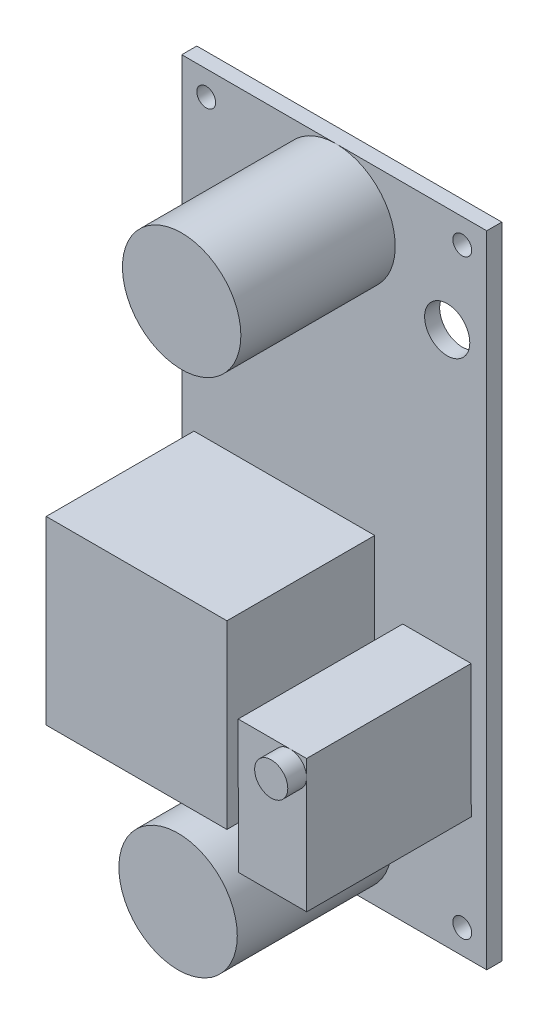
from build123d import *

# Parameters (mm, degrees)
SKETCH1_W           = 20.574
SKETCH1_H           = 43.18
BOSS_EXTRUDE1_DEPTH = 1.016
SKETCH2_R           = 1.524
CUT_EXTRUDE1_DEPTH  = 48.841761381
SKETCH3_R           = 0.635
CUT_EXTRUDE2_DEPTH  = 2.54
SKETCH4_W           = 0.79375
SKETCH4_H           = 0.071233975
SKETCH4_W_2         = 0.081410257
SKETCH4_H_2         = 0.305288462
SKETCH4_H_3         = 0.071233974
BOSS_EXTRUDE2_DEPTH = 0.00254
SKETCH5_W           = 12.192
SKETCH5_H           = 12.192
BOSS_EXTRUDE3_DEPTH = 9.9695
SKETCH6_R           = 3.99415
BOSS_EXTRUDE4_DEPTH = 10.414
BOSS_EXTRUDE5_DEPTH = 11.0998
SKETCH8_R           = 1.1176
BOSS_EXTRUDE6_DEPTH = 1.27


with BuildPart() as part:
    # Sketch1 → Boss-Extrude1 (new body)
    with BuildSketch(Plane.XY):
        with Locations((10.287, 21.59)):
            Rectangle(SKETCH1_W, SKETCH1_H)
    extrude(amount=BOSS_EXTRUDE1_DEPTH)

    # Sketch2 → Cut-Extrude1 (cut, through all)
    with BuildSketch(Plane.XY.offset(1.016)):
        with Locations((17.907, 36.068)):
            Circle(SKETCH2_R)
        with Locations((3.0988, 6.35)):
            Circle(SKETCH2_R)
    extrude(amount=-CUT_EXTRUDE1_DEPTH, mode=Mode.SUBTRACT)

    # Sketch3 → Cut-Extrude2 (cut)
    with BuildSketch(Plane.XY.offset(1.016)):
        with Locations((18.923, 41.529)):
            Circle(SKETCH3_R)
        with Locations((18.923, 1.651)):
            Circle(SKETCH3_R)
        with Locations((1.651, 1.651)):
            Circle(SKETCH3_R)
        with Locations((1.651, 41.529)):
            Circle(SKETCH3_R)
    extrude(amount=-CUT_EXTRUDE2_DEPTH, mode=Mode.SUBTRACT)

    # Sketch4 → Boss-Extrude2 (add)
    # profile 1 of 14: a face of its own
    with BuildSketch(Plane(origin=(0, 0, 0), x_dir=(-1, 0, 0), z_dir=(0, 0, -1))):
        Polygon((-17.848673525, 42.286725962), (-18.082728012, 42.286725962), (-18.082728012, 42.357959936), (-17.848673525, 42.357959936), (-17.848673525, 42.592014423), (-17.777439551, 42.592014423), (-17.777439551, 42.357959936), (-17.543385063, 42.357959936), (-17.543385063, 42.286725962), (-17.777439551, 42.286725962), (-17.777439551, 42.052671474), (-17.848673525, 42.052671474), align=None)
    # profile 2 of 14: a face of its own
    with BuildSketch(Plane(origin=(0, 0, 0), x_dir=(-1, 0, 0), z_dir=(0, 0, -1))):
        Polygon((-17.421269679, 41.279274038), (-18.215019679, 41.279274038), (-18.215019679, 41.294220453), (-17.590291363, 41.818616987), (-18.215019679, 41.818616987), (-18.215019679, 41.889850962), (-17.421269679, 41.889850962), (-17.421269679, 41.873632512), (-18.044566954, 41.350508013), (-17.421269679, 41.350508013), align=None)
    # profile 3 of 14: a face of its own
    with BuildSketch(Plane(origin=(0, 0, 0), x_dir=(-1, 0, 0), z_dir=(0, 0, -1))):
        with Locations((-17.818144679, 41.070660257)):
            Rectangle(SKETCH4_W, SKETCH4_H)
    # profile 4 of 14: a face of its own
    with BuildSketch(Plane(origin=(0, 0, 0), x_dir=(-1, 0, 0), z_dir=(0, 0, -1))):
        with Locations((-2.746900665, 42.32743109)):
            Rectangle(SKETCH4_W_2, SKETCH4_H_2)
    # profile 5 of 14: a face of its own
    with BuildSketch(Plane(origin=(0, 0, 0), x_dir=(-1, 0, 0), z_dir=(0, 0, -1))):
        Polygon((-2.441612203, 41.431918269), (-3.235362203, 41.431918269), (-3.235362203, 41.446864683), (-2.610633888, 41.971261218), (-3.235362203, 41.971261218), (-3.235362203, 42.042495192), (-2.441612203, 42.042495192), (-2.441612203, 42.026276743), (-3.064909479, 41.503152244), (-2.441612203, 41.503152244), align=None)
    # profile 6 of 14: a face of its own
    with BuildSketch(Plane(origin=(0, 0, 0), x_dir=(-1, 0, 0), z_dir=(0, 0, -1))):
        with Locations((-2.838487203, 41.223304487)):
            Rectangle(SKETCH4_W, SKETCH4_H_3)
    # profile 7 of 14: a face of its own
    with BuildSketch(Plane(origin=(0, 0, 0), x_dir=(-1, 0, 0), z_dir=(0, 0, -1))):
        with BuildLine():
            add(Edge.make_bspline(
                [(-18.235372243, 1.075856171), (-18.235006246, 1.090555326), (-18.234287397, 1.11942568), (-18.228603062, 1.161816811), (-18.21924724, 1.202408219), (-18.206034822, 1.241223241), (-18.188906583, 1.278114253), (-18.168100678, 1.313185445), (-18.143490664, 1.346331712), (-18.115437918, 1.377324896), (-18.084715583, 1.405597859), (-18.05182674, 1.430407531), (-18.017184889, 1.451336831), (-17.980788224, 1.468469742), (-17.94272172, 1.481920213), (-17.902772035, 1.491199415), (-17.861200825, 1.497127353), (-17.832846501, 1.497820335), (-17.818462688, 1.498171876)],
                knots=[0, 0, 0, 0, 1.065064174, 2.09187391, 3.093564831, 4.079973196, 5.057907931, 6.036227367, 7.030399151, 8.044883615, 9.061699972, 10.052012555, 11.025713132, 11.989727027, 12.962874294, 13.945865945, 14.957962116, 16, 16, 16, 16], degree=3))
            add(Edge.make_bspline(
                [(-17.818462688, 1.498171876), (-17.804184912, 1.497820217), (-17.776041763, 1.497127054), (-17.734733171, 1.491194605), (-17.695028998, 1.481878809), (-17.65701774, 1.468636278), (-17.620694998, 1.451490219), (-17.586026922, 1.430530108), (-17.553050233, 1.405767522), (-17.522116245, 1.37761462), (-17.493818809, 1.346833758), (-17.468859368, 1.314071317), (-17.447920958, 1.27943039), (-17.430596773, 1.24326996), (-17.417426608, 1.205306084), (-17.407838293, 1.165815025), (-17.401969203, 1.124581624), (-17.401271659, 1.096493068), (-17.400917115, 1.082216348)],
                knots=[0, 0, 0, 0, 1.043748596, 2.057349401, 3.045489418, 4.02252776, 4.995289225, 5.97782527, 6.980224157, 8.006516136, 9.032559198, 10.034193337, 11.013412982, 11.987833483, 12.961212594, 13.946489799, 14.956251404, 16, 16, 16, 16], degree=3))
            add(Edge.make_bspline(
                [(-17.400917115, 1.082216348), (-17.401268493, 1.067832618), (-17.401961155, 1.039478458), (-17.407898723, 0.997854881), (-17.417183626, 0.957877607), (-17.43045273, 0.919660959), (-17.447601638, 0.883183627), (-17.468512274, 0.848374269), (-17.493324251, 0.815372605), (-17.521483456, 0.784452245), (-17.552138433, 0.756160909), (-17.584984773, 0.731495836), (-17.619378064, 0.710580498), (-17.655413752, 0.693489171), (-17.692917633, 0.679958124), (-17.732139877, 0.670726852), (-17.772856872, 0.664754235), (-17.800579815, 0.664065975), (-17.814646582, 0.663716748)],
                knots=[0, 0, 0, 0, 1.053102029, 2.075944431, 3.073151272, 4.055350789, 5.033113405, 6.020478099, 7.024410459, 8.052272461, 9.079885166, 10.07527673, 11.055994387, 12.023226415, 12.992069828, 13.970394897, 14.97016774, 16, 16, 16, 16], degree=3))
            add(Edge.make_bspline(
                [(-17.814646582, 0.663716748), (-17.824088276, 0.663837996), (-17.842852554, 0.664078962), (-17.870716944, 0.666979935), (-17.898133218, 0.671189464), (-17.925023415, 0.677222397), (-17.95132171, 0.68511265), (-17.977209472, 0.694422664), (-18.002424353, 0.705793664), (-18.0270858, 0.718648026), (-18.050809379, 0.7329949), (-18.073233856, 0.748841722), (-18.094547403, 0.765631886), (-18.114197706, 0.784038584), (-18.13275641, 0.80345517), (-18.149938312, 0.824196624), (-18.165898346, 0.846136383), (-18.180281173, 0.869368851), (-18.193289405, 0.893321567), (-18.204452218, 0.918013265), (-18.214033021, 0.943108595), (-18.221798351, 0.968725095), (-18.227928831, 0.994794742), (-18.232103356, 1.021374432), (-18.235011728, 1.048442991), (-18.235251554, 1.06667913), (-18.235372243, 1.075856171)],
                knots=[0, 0, 0, 0, 1.037015668, 2.060948919, 3.074880161, 4.083647147, 5.086022904, 6.090072063, 7.104153813, 8.122640571, 9.144368836, 10.147691507, 11.138137339, 12.123020368, 13.103399296, 14.087645067, 15.080126199, 16.082011238, 17.087798457, 18.072939717, 19.057185487, 20.037253025, 21.01195951, 21.997135196, 22.992090687, 24, 24, 24, 24], degree=3))
        make_face()
        with BuildLine():
            add(Edge.make_bspline(
                [(-18.153961986, 1.079354268), (-18.153870483, 1.071821568), (-18.153688352, 1.056828179), (-18.151276124, 1.034540075), (-18.14786271, 1.012538327), (-18.142905235, 0.990865513), (-18.136492957, 0.96947618), (-18.128759243, 0.948360832), (-18.119411891, 0.927591868), (-18.108899658, 0.907195232), (-18.096959443, 0.887642022), (-18.0842801, 0.868885146), (-18.070390525, 0.851412487), (-18.055591099, 0.83498402), (-18.039753387, 0.819640601), (-18.022981396, 0.805388997), (-18.005202585, 0.792240895), (-17.986490119, 0.780354528), (-17.966948474, 0.769776589), (-17.946951204, 0.760305717), (-17.926263297, 0.752454725), (-17.905013853, 0.746235569), (-17.883296514, 0.740956932), (-17.860992955, 0.737645779), (-17.838180065, 0.735209784), (-17.822762664, 0.735037741), (-17.814964591, 0.734950723)],
                knots=[0, 0, 0, 0, 1.008406545, 2.007172654, 2.999155034, 3.989332444, 4.982025741, 5.988181096, 6.998684226, 8.030553839, 9.059268815, 10.065399129, 11.060956322, 12.046057109, 13.024974577, 14.012068307, 14.991706172, 15.984221787, 16.978487447, 17.966117052, 18.945677757, 19.938371053, 20.93015022, 21.936155317, 22.956113857, 24, 24, 24, 24], degree=3))
            add(Edge.make_bspline(
                [(-17.814964591, 0.734950723), (-17.803498062, 0.735240505), (-17.780939853, 0.735810595), (-17.747878001, 0.740780821), (-17.716073226, 0.748497586), (-17.685715099, 0.759685439), (-17.656668243, 0.773957752), (-17.629045699, 0.791367078), (-17.602855614, 0.812072847), (-17.578292949, 0.835578949), (-17.555882556, 0.861282251), (-17.536183703, 0.888562295), (-17.519604599, 0.917203249), (-17.505744841, 0.947040035), (-17.495303475, 0.978327394), (-17.487858787, 1.010864724), (-17.483033673, 1.044652744), (-17.482565039, 1.067677321), (-17.482327371, 1.079354268)],
                knots=[0, 0, 0, 0, 1.032022337, 2.030307203, 3.003823408, 3.974715386, 4.937372378, 5.913284036, 6.909147208, 7.938749767, 8.970518239, 9.975863271, 10.963918693, 11.946286286, 12.933361397, 13.927862637, 14.949112547, 16, 16, 16, 16], degree=3))
            add(Edge.make_bspline(
                [(-17.482327371, 1.079354268), (-17.482435122, 1.08720324), (-17.482648823, 1.102770107), (-17.484804263, 1.125923461), (-17.488253848, 1.148661836), (-17.493245074, 1.170943221), (-17.499409188, 1.192796808), (-17.507055136, 1.214156657), (-17.516220796, 1.235015675), (-17.526435619, 1.255476429), (-17.538039384, 1.275080784), (-17.550547797, 1.293723885), (-17.564192296, 1.311166441), (-17.57879296, 1.3275872), (-17.594581987, 1.342823088), (-17.611252048, 1.357034115), (-17.629068593, 1.369954882), (-17.647704417, 1.381800954), (-17.667103591, 1.39250796), (-17.687155839, 1.401704885), (-17.707753613, 1.409559249), (-17.728912047, 1.415890756), (-17.750583548, 1.420854682), (-17.772799132, 1.424274425), (-17.795513815, 1.426666705), (-17.810877157, 1.426847011), (-17.818621692, 1.426937902)],
                knots=[0, 0, 0, 0, 1.047334373, 2.07717862, 3.100662057, 4.115010574, 5.122652213, 6.129548646, 7.140165612, 8.16200981, 9.179904151, 10.178566626, 11.156366481, 12.133321541, 13.108841334, 14.082538371, 15.054589433, 16.043660176, 17.028268541, 18.009491307, 18.985652105, 19.968123554, 20.954864208, 21.950389976, 22.966808393, 24, 24, 24, 24], degree=3))
            add(Edge.make_bspline(
                [(-17.818621692, 1.426937902), (-17.826313244, 1.426846935), (-17.841570854, 1.426666486), (-17.864127147, 1.424275604), (-17.886182786, 1.420850937), (-17.907651184, 1.415915466), (-17.928537814, 1.409554092), (-17.948823057, 1.401710179), (-17.968582492, 1.392460659), (-17.987767252, 1.38184521), (-18.00617659, 1.369912738), (-18.023775461, 1.356873697), (-18.040234844, 1.34250397), (-18.055955513, 1.327210359), (-18.07062302, 1.310625173), (-18.084180694, 1.292745516), (-18.097239397, 1.27401657), (-18.108796494, 1.254014793), (-18.119522891, 1.233446289), (-18.128674153, 1.212321281), (-18.136533791, 1.190941465), (-18.142924377, 1.169221362), (-18.14784372, 1.147171237), (-18.151279179, 1.124803914), (-18.153687524, 1.102197468), (-18.153870208, 1.086992831), (-18.153961986, 1.079354268)],
                knots=[0, 0, 0, 0, 1.029877221, 2.042951179, 3.035109885, 4.018542222, 4.991021277, 5.957494829, 6.929429462, 7.911425532, 8.892163142, 9.866273635, 10.842761649, 11.81676864, 12.802607151, 13.805177466, 14.821356543, 15.858816981, 16.897175917, 17.927346774, 18.940346092, 19.946830556, 20.957962087, 21.964146003, 22.97721996, 24, 24, 24, 24], degree=3))
        make_face(mode=Mode.SUBTRACT)
    # profile 8 of 14: a face of its own
    with BuildSketch(Plane(origin=(0, 0, 0), x_dir=(-1, 0, 0), z_dir=(0, 0, -1))):
        with BuildLine():
            Line((-18.215019679, 1.660992389), (-18.215019679, 1.732226364))
            Line((-18.215019679, 1.732226364), (-17.739437497, 1.732226364))
            add(Edge.make_bspline(
                [(-17.739437497, 1.732226364), (-17.73270633, 1.732215763), (-17.719932781, 1.732195646), (-17.701751756, 1.73233002), (-17.685588181, 1.732706341), (-17.67137975, 1.732943595), (-17.659191663, 1.733471401), (-17.648957887, 1.733901851), (-17.64072688, 1.734455334), (-17.635923349, 1.735120523), (-17.633858571, 1.735406452)],
                knots=[0, 0, 0, 0, 1.528628734, 2.90083645, 4.128790002, 5.200304208, 6.127813768, 6.898992206, 7.526736466, 8, 8, 8, 8], degree=3))
            add(Edge.make_bspline(
                [(-17.633858571, 1.735406452), (-17.62635228, 1.736567251), (-17.611861722, 1.738808121), (-17.59124176, 1.744761694), (-17.572623805, 1.752698767), (-17.555587904, 1.76254518), (-17.54024232, 1.774986165), (-17.526469275, 1.790432033), (-17.513953078, 1.808605859), (-17.503040753, 1.829247266), (-17.493977148, 1.851240722), (-17.487195246, 1.87379776), (-17.483044725, 1.896483032), (-17.482565397, 1.911672669), (-17.482327371, 1.919215546)],
                knots=[0, 0, 0, 0, 1.042777144, 2.01303441, 2.939567723, 3.817555404, 4.708046775, 5.641195415, 6.651191522, 7.732783915, 8.843021186, 9.914367358, 10.964315445, 12, 12, 12, 12], degree=3))
            add(Edge.make_bspline(
                [(-17.482327371, 1.919215546), (-17.482569555, 1.925691696), (-17.483052524, 1.938606591), (-17.486080133, 1.957785642), (-17.491429047, 1.976523967), (-17.498715245, 1.994674361), (-17.507675315, 2.011941849), (-17.518409332, 2.027883715), (-17.530912384, 2.042170214), (-17.544769217, 2.055207442), (-17.560384265, 2.066493473), (-17.577380814, 2.076472089), (-17.596212068, 2.084396945), (-17.609438251, 2.088409275), (-17.616209082, 2.090463293)],
                knots=[0, 0, 0, 0, 0.994718802, 1.98369237, 2.973235266, 3.981451368, 4.982709966, 5.955777334, 6.925228988, 7.892833478, 8.871333226, 9.877970804, 10.913677552, 12, 12, 12, 12], degree=3))
            add(Edge.make_bspline(
                [(-17.616209082, 2.090463293), (-17.619009562, 2.091143678), (-17.625250161, 2.092659852), (-17.635800525, 2.094076592), (-17.648248648, 2.095552179), (-17.66268397, 2.096576019), (-17.679058119, 2.097574153), (-17.697456396, 2.098171296), (-17.717811992, 2.098447302), (-17.732017206, 2.098529553), (-17.739437497, 2.098572518)],
                knots=[0, 0, 0, 0, 0.558680831, 1.244966039, 2.062412453, 2.990489873, 4.051219941, 5.244515665, 6.560634259, 8, 8, 8, 8], degree=3))
            Line((-17.739437497, 2.098572518), (-18.215019679, 2.098572518))
            Line((-18.215019679, 2.098572518), (-18.215019679, 2.169806492))
            Line((-18.215019679, 2.169806492), (-17.735621392, 2.169806492))
            add(Edge.make_bspline(
                [(-17.735621392, 2.169806492), (-17.726981225, 2.169748853), (-17.710119415, 2.169636367), (-17.68541078, 2.168661171), (-17.661971884, 2.167105699), (-17.639799097, 2.164909962), (-17.618973411, 2.161993969), (-17.599357652, 2.15878121), (-17.581059969, 2.154618267), (-17.563869254, 2.149791786), (-17.547422608, 2.144353002), (-17.531844499, 2.137185029), (-17.516677396, 2.129144183), (-17.50209113, 2.119684551), (-17.488178375, 2.108801656), (-17.474578981, 2.096912435), (-17.461698248, 2.083597827), (-17.449377313, 2.069251103), (-17.43791884, 2.053968725), (-17.427947371, 2.037652013), (-17.419827892, 2.020391052), (-17.412621693, 2.002594567), (-17.407499711, 1.983835879), (-17.403605234, 1.964348652), (-17.401410977, 1.944017298), (-17.401083131, 1.930191724), (-17.400917115, 1.923190657)],
                knots=[0, 0, 0, 0, 1.316707045, 2.569633854, 3.76780728, 4.896239288, 5.964314126, 6.972204208, 7.924543903, 8.822147865, 9.693191779, 10.560896119, 11.431827672, 12.307838457, 13.206132673, 14.12176355, 15.058527151, 16.026630406, 17.00238624, 17.966538933, 18.934743273, 19.906713913, 20.888635248, 21.892958714, 22.933025263, 24, 24, 24, 24], degree=3))
            add(Edge.make_bspline(
                [(-17.400917115, 1.923190657), (-17.401094965, 1.915554929), (-17.401443906, 1.90057366), (-17.403446527, 1.878499567), (-17.407208976, 1.857334361), (-17.412030737, 1.836871477), (-17.418572259, 1.817308609), (-17.426610044, 1.798651521), (-17.435786396, 1.780685991), (-17.446629704, 1.763816778), (-17.458453601, 1.7479055), (-17.471440856, 1.733445785), (-17.485096846, 1.720070574), (-17.49993579, 1.708369416), (-17.51565392, 1.697899734), (-17.532325166, 1.688892233), (-17.549927179, 1.681155104), (-17.562163091, 1.677162285), (-17.568348755, 1.675143782)],
                knots=[0, 0, 0, 0, 1.138939089, 2.234594419, 3.301501784, 4.342532435, 5.367382236, 6.373123747, 7.370098489, 8.372230273, 9.360297234, 10.323289009, 11.268038109, 12.20748145, 13.137029304, 14.081414587, 15.030090602, 16, 16, 16, 16], degree=3))
            add(Edge.make_bspline(
                [(-17.568348755, 1.675143782), (-17.572574357, 1.673969676), (-17.581739781, 1.671423015), (-17.596908681, 1.668695849), (-17.614374564, 1.666403254), (-17.634138626, 1.664247529), (-17.656216185, 1.662975498), (-17.680597671, 1.661860293), (-17.707312566, 1.660984533), (-17.725921358, 1.660989697), (-17.735621392, 1.660992389)],
                knots=[0, 0, 0, 0, 0.625038921, 1.35572334, 2.194682327, 3.136881307, 4.189498639, 5.346923369, 6.617055217, 8, 8, 8, 8], degree=3))
            Line((-17.735621392, 1.660992389), (-18.215019679, 1.660992389))
        make_face()
    # profile 9 of 14: a face of its own
    with BuildSketch(Plane(origin=(0, 0, 0), x_dir=(-1, 0, 0), z_dir=(0, 0, -1))):
        Polygon((-18.133609422, 2.291921876), (-18.215019679, 2.291921876), (-18.215019679, 2.709149441), (-18.133609422, 2.709149441), (-18.133609422, 2.536152646), (-17.421269679, 2.536152646), (-17.421269679, 2.464918671), (-18.133609422, 2.464918671), align=None)
    # profile 10 of 14: a face of its own
    with BuildSketch(Plane(origin=(0, 0, 0), x_dir=(-1, 0, 0), z_dir=(0, 0, -1))):
        Polygon((-17.848673525, 3.044966748), (-18.082728012, 3.044966748), (-18.082728012, 3.116200723), (-17.848673525, 3.116200723), (-17.848673525, 3.35025521), (-17.777439551, 3.35025521), (-17.777439551, 3.116200723), (-17.543385063, 3.116200723), (-17.543385063, 3.044966748), (-17.777439551, 3.044966748), (-17.777439551, 2.810912261), (-17.848673525, 2.810912261), align=None)
    # profile 11 of 14: a face of its own
    with BuildSketch(Plane(origin=(0, 0, 0), x_dir=(-1, 0, 0), z_dir=(0, 0, -1))):
        with BuildLine():
            add(Edge.make_bspline(
                [(-3.255714767, 1.228500356), (-3.25534877, 1.243199511), (-3.254629921, 1.272069864), (-3.248945586, 1.314460995), (-3.239589764, 1.355052404), (-3.226377347, 1.393867425), (-3.209249107, 1.430758437), (-3.188443202, 1.465829629), (-3.163833189, 1.498975897), (-3.135780442, 1.52996908), (-3.105058107, 1.558242044), (-3.072169264, 1.583051716), (-3.037527413, 1.603981015), (-3.001130748, 1.621113927), (-2.963064244, 1.634564398), (-2.923114559, 1.6438436), (-2.88154335, 1.649771537), (-2.853189025, 1.650464519), (-2.838805212, 1.650816061)],
                knots=[0, 0, 0, 0, 1.065064174, 2.09187391, 3.093564831, 4.079973196, 5.057907931, 6.036227367, 7.030399151, 8.044883615, 9.061699972, 10.052012555, 11.025713132, 11.989727027, 12.962874294, 13.945865945, 14.957962116, 16, 16, 16, 16], degree=3))
            add(Edge.make_bspline(
                [(-2.838805212, 1.650816061), (-2.824527436, 1.650464401), (-2.796384287, 1.649771238), (-2.755075695, 1.64383879), (-2.715371522, 1.634522994), (-2.677360264, 1.621280462), (-2.641037522, 1.604134404), (-2.606369446, 1.583174293), (-2.573392757, 1.558411706), (-2.54245877, 1.530258805), (-2.514161333, 1.499477943), (-2.489201892, 1.466715501), (-2.468263482, 1.432074574), (-2.450939297, 1.395914144), (-2.437769132, 1.357950268), (-2.428180817, 1.31845921), (-2.422311727, 1.277225808), (-2.421614183, 1.249137252), (-2.421259639, 1.234860532)],
                knots=[0, 0, 0, 0, 1.043748596, 2.057349401, 3.045489418, 4.02252776, 4.995289225, 5.97782527, 6.980224157, 8.006516136, 9.032559198, 10.034193337, 11.013412982, 11.987833483, 12.961212594, 13.946489799, 14.956251404, 16, 16, 16, 16], degree=3))
            add(Edge.make_bspline(
                [(-2.421259639, 1.234860532), (-2.421611018, 1.220476803), (-2.422303679, 1.192122643), (-2.428241248, 1.150499065), (-2.43752615, 1.110521791), (-2.450795255, 1.072305144), (-2.467944162, 1.035827811), (-2.488854798, 1.001018453), (-2.513666775, 0.96801679), (-2.54182598, 0.937096429), (-2.572480957, 0.908805093), (-2.605327297, 0.884140021), (-2.639720588, 0.863224682), (-2.675756277, 0.846133355), (-2.713260158, 0.832602308), (-2.752482402, 0.823371037), (-2.793199397, 0.817398419), (-2.82092234, 0.816710159), (-2.834989106, 0.816360933)],
                knots=[0, 0, 0, 0, 1.053102029, 2.075944431, 3.073151272, 4.055350789, 5.033113405, 6.020478099, 7.024410459, 8.052272461, 9.079885166, 10.07527673, 11.055994387, 12.023226415, 12.992069828, 13.970394897, 14.97016774, 16, 16, 16, 16], degree=3))
            add(Edge.make_bspline(
                [(-2.834989106, 0.816360933), (-2.844430801, 0.81648218), (-2.863195079, 0.816723146), (-2.891059468, 0.819624119), (-2.918475743, 0.823833648), (-2.94536594, 0.829866582), (-2.971664234, 0.837756835), (-2.997551997, 0.847066848), (-3.022766877, 0.858437849), (-3.047428325, 0.87129221), (-3.071151903, 0.885639084), (-3.09357638, 0.901485906), (-3.114889928, 0.91827607), (-3.13454023, 0.936682768), (-3.153098935, 0.956099355), (-3.170280836, 0.976840808), (-3.18624087, 0.998780567), (-3.200623697, 1.022013036), (-3.21363193, 1.045965752), (-3.224794742, 1.070657449), (-3.234375546, 1.095752779), (-3.242140876, 1.12136928), (-3.248271355, 1.147438926), (-3.25244588, 1.174018617), (-3.255354252, 1.201087176), (-3.255594078, 1.219323314), (-3.255714767, 1.228500356)],
                knots=[0, 0, 0, 0, 1.037015668, 2.060948919, 3.074880161, 4.083647147, 5.086022904, 6.090072063, 7.104153813, 8.122640571, 9.144368836, 10.147691507, 11.138137339, 12.123020368, 13.103399296, 14.087645067, 15.080126199, 16.082011238, 17.087798457, 18.072939717, 19.057185487, 20.037253025, 21.01195951, 21.997135196, 22.992090687, 24, 24, 24, 24], degree=3))
        make_face()
        with BuildLine():
            add(Edge.make_bspline(
                [(-3.174304511, 1.231998453), (-3.174213008, 1.224465752), (-3.174030876, 1.209472364), (-3.171618649, 1.187184259), (-3.168205234, 1.165182512), (-3.163247759, 1.143509697), (-3.156835481, 1.122120364), (-3.149101767, 1.101005017), (-3.139754415, 1.080236052), (-3.129242182, 1.059839417), (-3.117301967, 1.040286206), (-3.104622625, 1.02152933), (-3.090733049, 1.004056671), (-3.075933623, 0.987628204), (-3.060095911, 0.972284785), (-3.043323921, 0.958033181), (-3.025545109, 0.94488508), (-3.006832643, 0.932998712), (-2.987290999, 0.922420773), (-2.967293728, 0.912949901), (-2.946605821, 0.905098909), (-2.925356377, 0.898879754), (-2.903639038, 0.893601116), (-2.881335479, 0.890289964), (-2.858522589, 0.887853968), (-2.843105188, 0.887681926), (-2.835307115, 0.887594907)],
                knots=[0, 0, 0, 0, 1.008406545, 2.007172654, 2.999155034, 3.989332444, 4.982025741, 5.988181096, 6.998684226, 8.030553839, 9.059268815, 10.065399129, 11.060956322, 12.046057109, 13.024974577, 14.012068307, 14.991706172, 15.984221787, 16.978487447, 17.966117052, 18.945677757, 19.938371053, 20.93015022, 21.936155317, 22.956113857, 24, 24, 24, 24], degree=3))
            add(Edge.make_bspline(
                [(-2.835307115, 0.887594907), (-2.823840586, 0.887884689), (-2.801282377, 0.88845478), (-2.768220525, 0.893425005), (-2.736415751, 0.901141771), (-2.706057623, 0.912329623), (-2.677010767, 0.926601937), (-2.649388223, 0.944011262), (-2.623198139, 0.964717031), (-2.598635473, 0.988223133), (-2.576225081, 1.013926436), (-2.556526228, 1.041206479), (-2.539947124, 1.069847433), (-2.526087365, 1.099684219), (-2.515646, 1.130971578), (-2.508201311, 1.163508908), (-2.503376197, 1.197296928), (-2.502907563, 1.220321505), (-2.502669895, 1.231998453)],
                knots=[0, 0, 0, 0, 1.032022337, 2.030307203, 3.003823408, 3.974715386, 4.937372378, 5.913284036, 6.909147208, 7.938749767, 8.970518239, 9.975863271, 10.963918693, 11.946286286, 12.933361397, 13.927862637, 14.949112547, 16, 16, 16, 16], degree=3))
            add(Edge.make_bspline(
                [(-2.502669895, 1.231998453), (-2.502777646, 1.239847424), (-2.502991348, 1.255414292), (-2.505146787, 1.278567645), (-2.508596373, 1.30130602), (-2.513587598, 1.323587405), (-2.519751712, 1.345440992), (-2.527397661, 1.366800842), (-2.53656332, 1.387659859), (-2.546778144, 1.408120614), (-2.558381908, 1.427724969), (-2.570890322, 1.446368069), (-2.584534821, 1.463810625), (-2.599135484, 1.480231384), (-2.614924511, 1.495467272), (-2.631594572, 1.509678299), (-2.649411117, 1.522599066), (-2.668046941, 1.534445138), (-2.687446115, 1.545152145), (-2.707498363, 1.554349069), (-2.728096137, 1.562203433), (-2.749254572, 1.568534941), (-2.770926072, 1.573498866), (-2.793141656, 1.576918609), (-2.815856339, 1.57931089), (-2.831219681, 1.579491196), (-2.838964216, 1.579582087)],
                knots=[0, 0, 0, 0, 1.047334373, 2.07717862, 3.100662057, 4.115010574, 5.122652213, 6.129548646, 7.140165612, 8.16200981, 9.179904151, 10.178566626, 11.156366481, 12.133321541, 13.108841334, 14.082538371, 15.054589433, 16.043660176, 17.028268541, 18.009491307, 18.985652105, 19.968123554, 20.954864208, 21.950389976, 22.966808393, 24, 24, 24, 24], degree=3))
            add(Edge.make_bspline(
                [(-2.838964216, 1.579582087), (-2.846655768, 1.57949112), (-2.861913378, 1.579310671), (-2.884469671, 1.576919788), (-2.90652531, 1.573495122), (-2.927993708, 1.56855965), (-2.948880338, 1.562198277), (-2.969165581, 1.554354363), (-2.988925016, 1.545104843), (-3.008109776, 1.534489394), (-3.026519114, 1.522556923), (-3.044117985, 1.509517881), (-3.060577369, 1.495148154), (-3.076298037, 1.479854543), (-3.090965544, 1.463269357), (-3.104523218, 1.445389701), (-3.117581921, 1.426660755), (-3.129139018, 1.406658978), (-3.139865415, 1.386090473), (-3.149016677, 1.364965465), (-3.156876316, 1.343585649), (-3.163266901, 1.321865546), (-3.168186245, 1.299815421), (-3.171621703, 1.277448099), (-3.174030048, 1.254841652), (-3.174212733, 1.239637016), (-3.174304511, 1.231998453)],
                knots=[0, 0, 0, 0, 1.029877221, 2.042951179, 3.035109885, 4.018542222, 4.991021277, 5.957494829, 6.929429462, 7.911425532, 8.892163142, 9.866273635, 10.842761649, 11.81676864, 12.802607151, 13.805177466, 14.821356543, 15.858816981, 16.897175917, 17.927346774, 18.940346092, 19.946830556, 20.957962087, 21.964146003, 22.97721996, 24, 24, 24, 24], degree=3))
        make_face(mode=Mode.SUBTRACT)
    # profile 12 of 14: a face of its own
    with BuildSketch(Plane(origin=(0, 0, 0), x_dir=(-1, 0, 0), z_dir=(0, 0, -1))):
        with BuildLine():
            Line((-3.235362203, 1.813636574), (-3.235362203, 1.884870548))
            Line((-3.235362203, 1.884870548), (-2.759780022, 1.884870548))
            add(Edge.make_bspline(
                [(-2.759780022, 1.884870548), (-2.753048855, 1.884859947), (-2.740275306, 1.88483983), (-2.72209428, 1.884974204), (-2.705930705, 1.885350525), (-2.691722274, 1.885587779), (-2.679534187, 1.886115585), (-2.669300411, 1.886546035), (-2.661069404, 1.887099518), (-2.656265873, 1.887764707), (-2.654201095, 1.888050636)],
                knots=[0, 0, 0, 0, 1.528628734, 2.90083645, 4.128790002, 5.200304208, 6.127813768, 6.898992206, 7.526736466, 8, 8, 8, 8], degree=3))
            add(Edge.make_bspline(
                [(-2.654201095, 1.888050636), (-2.646694804, 1.889211435), (-2.632204247, 1.891452305), (-2.611584284, 1.897405879), (-2.592966329, 1.905342951), (-2.575930428, 1.915189364), (-2.560584844, 1.927630349), (-2.546811799, 1.943076217), (-2.534295602, 1.961250043), (-2.523383278, 1.98189145), (-2.514319673, 2.003884906), (-2.50753777, 2.026441945), (-2.50338725, 2.049127216), (-2.502907921, 2.064316853), (-2.502669895, 2.071859731)],
                knots=[0, 0, 0, 0, 1.042777144, 2.01303441, 2.939567723, 3.817555404, 4.708046775, 5.641195415, 6.651191522, 7.732783915, 8.843021186, 9.914367358, 10.964315445, 12, 12, 12, 12], degree=3))
            add(Edge.make_bspline(
                [(-2.502669895, 2.071859731), (-2.502912079, 2.07833588), (-2.503395048, 2.091250775), (-2.506422657, 2.110429826), (-2.511771571, 2.129168152), (-2.519057769, 2.147318546), (-2.528017839, 2.164586034), (-2.538751857, 2.180527899), (-2.551254909, 2.194814399), (-2.565111741, 2.207851626), (-2.580726789, 2.219137657), (-2.597723338, 2.229116274), (-2.616554592, 2.237041129), (-2.629780776, 2.24105346), (-2.636551606, 2.243107477)],
                knots=[0, 0, 0, 0, 0.994718802, 1.98369237, 2.973235266, 3.981451368, 4.982709966, 5.955777334, 6.925228988, 7.892833478, 8.871333226, 9.877970804, 10.913677552, 12, 12, 12, 12], degree=3))
            add(Edge.make_bspline(
                [(-2.636551606, 2.243107477), (-2.639352086, 2.243787863), (-2.645592685, 2.245304036), (-2.656143049, 2.246720776), (-2.668591173, 2.248196364), (-2.683026494, 2.249220203), (-2.699400644, 2.250218337), (-2.71779892, 2.250815481), (-2.738154516, 2.251091486), (-2.75235973, 2.251173737), (-2.759780022, 2.251216702)],
                knots=[0, 0, 0, 0, 0.558680831, 1.244966039, 2.062412453, 2.990489873, 4.051219941, 5.244515665, 6.560634259, 8, 8, 8, 8], degree=3))
            Line((-2.759780022, 2.251216702), (-3.235362203, 2.251216702))
            Line((-3.235362203, 2.251216702), (-3.235362203, 2.322450676))
            Line((-3.235362203, 2.322450676), (-2.755963916, 2.322450676))
            add(Edge.make_bspline(
                [(-2.755963916, 2.322450676), (-2.747323749, 2.322393037), (-2.730461939, 2.322280551), (-2.705753304, 2.321305356), (-2.682314408, 2.319749883), (-2.660141621, 2.317554146), (-2.639315936, 2.314638153), (-2.619700177, 2.311425394), (-2.601402493, 2.307262452), (-2.584211778, 2.302435971), (-2.567765132, 2.296997186), (-2.552187023, 2.289829213), (-2.53701992, 2.281788367), (-2.522433655, 2.272328735), (-2.508520899, 2.261445841), (-2.494921506, 2.24955662), (-2.482040773, 2.236242011), (-2.469719837, 2.221895288), (-2.458261364, 2.206612909), (-2.448289895, 2.190296198), (-2.440170416, 2.173035236), (-2.432964218, 2.155238752), (-2.427842235, 2.136480063), (-2.423947758, 2.116992836), (-2.421753501, 2.096661483), (-2.421425655, 2.082835908), (-2.421259639, 2.075834841)],
                knots=[0, 0, 0, 0, 1.316707045, 2.569633854, 3.76780728, 4.896239288, 5.964314126, 6.972204208, 7.924543903, 8.822147865, 9.693191779, 10.560896119, 11.431827672, 12.307838457, 13.206132673, 14.12176355, 15.058527151, 16.026630406, 17.00238624, 17.966538933, 18.934743273, 19.906713913, 20.888635248, 21.892958714, 22.933025263, 24, 24, 24, 24], degree=3))
            add(Edge.make_bspline(
                [(-2.421259639, 2.075834841), (-2.421437489, 2.068199114), (-2.421786431, 2.053217844), (-2.423789051, 2.031143751), (-2.4275515, 2.009978546), (-2.432373262, 1.989515662), (-2.438914783, 1.969952793), (-2.446952568, 1.951295705), (-2.456128921, 1.933330175), (-2.466972228, 1.916460963), (-2.478796126, 1.900549684), (-2.49178338, 1.88608997), (-2.505439371, 1.872714759), (-2.520278314, 1.861013601), (-2.535996444, 1.850543918), (-2.55266769, 1.841536417), (-2.570269703, 1.833799288), (-2.582505615, 1.82980647), (-2.58869128, 1.827787966)],
                knots=[0, 0, 0, 0, 1.138939089, 2.234594419, 3.301501784, 4.342532435, 5.367382236, 6.373123747, 7.370098489, 8.372230273, 9.360297234, 10.323289009, 11.268038109, 12.20748145, 13.137029304, 14.081414587, 15.030090602, 16, 16, 16, 16], degree=3))
            add(Edge.make_bspline(
                [(-2.58869128, 1.827787966), (-2.592916881, 1.82661386), (-2.602082305, 1.824067199), (-2.617251206, 1.821340034), (-2.634717089, 1.819047438), (-2.65448115, 1.816891714), (-2.676558709, 1.815619682), (-2.700940196, 1.814504477), (-2.727655091, 1.813628717), (-2.746263882, 1.813633882), (-2.755963916, 1.813636574)],
                knots=[0, 0, 0, 0, 0.625038921, 1.35572334, 2.194682327, 3.136881307, 4.189498639, 5.346923369, 6.617055217, 8, 8, 8, 8], degree=3))
            Line((-2.755963916, 1.813636574), (-3.235362203, 1.813636574))
        make_face()
    # profile 13 of 14: a face of its own
    with BuildSketch(Plane(origin=(0, 0, 0), x_dir=(-1, 0, 0), z_dir=(0, 0, -1))):
        Polygon((-3.153951947, 2.444566061), (-3.235362203, 2.444566061), (-3.235362203, 2.861793625), (-3.153951947, 2.861793625), (-3.153951947, 2.68879683), (-2.441612203, 2.68879683), (-2.441612203, 2.617562856), (-3.153951947, 2.617562856), align=None)
    # profile 14 of 14: a face of its own
    with BuildSketch(Plane(origin=(0, 0, 0), x_dir=(-1, 0, 0), z_dir=(0, 0, -1))):
        with Locations((-2.746900665, 3.08567183)):
            Rectangle(SKETCH4_W_2, SKETCH4_H_2)
    extrude(amount=BOSS_EXTRUDE2_DEPTH)

    # Sketch5 → Boss-Extrude3 (add)
    with BuildSketch(Plane.XY.offset(1.016)):
        with Locations((6.9215, 15.5067)):
            Rectangle(SKETCH5_W, SKETCH5_H)
    extrude(amount=BOSS_EXTRUDE3_DEPTH)

    # Sketch6 → Boss-Extrude4 (add)
    with BuildSketch(Plane.XY.offset(1.016)):
        with Locations((10.40765, 39.18585)):
            Circle(SKETCH6_R)
        with Locations((10.16635, 3.99415)):
            Circle(SKETCH6_R)
    extrude(amount=BOSS_EXTRUDE4_DEPTH)

    # Sketch7 → Boss-Extrude5 (add)
    with BuildSketch(Plane.XY.offset(1.016)):
        Polygon((14.90729124, 17.374447806), (19.521438347, 17.374447806), (19.530013473, 8.4201), (14.915866367, 8.4201), align=None)
    extrude(amount=BOSS_EXTRUDE5_DEPTH)

    # Sketch8 → Boss-Extrude6 (add)
    with BuildSketch(Plane.XY.offset(12.1158)):
        with Locations((18.404908616, 16.256847806)):
            Circle(SKETCH8_R)
    extrude(amount=BOSS_EXTRUDE6_DEPTH)


solid = part.part
